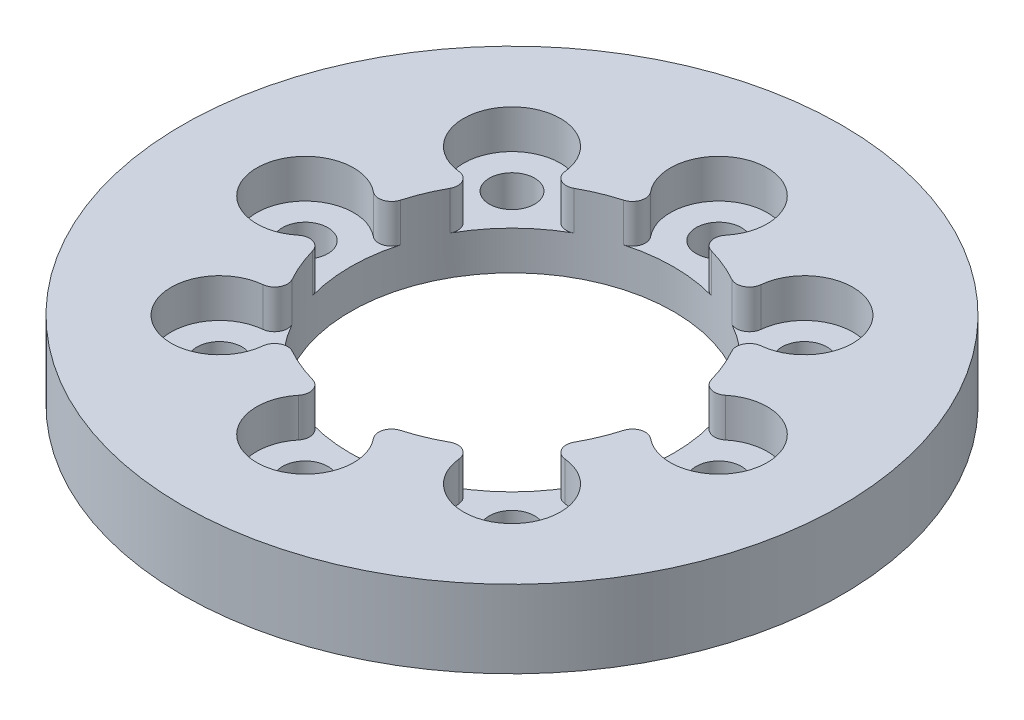
from build123d import *

# Parameters (mm, degrees)
SKETCH1_R           = 25.5
SKETCH1_R_2         = 12.5
SKETCH1_R_3         = 1.75
BOSS_EXTRUDE1_DEPTH = 6
CUT_EXTRUDE1_START  = -3
SKETCH2_R           = 3.75
SKETCH2_R_2         = 1.75
CUT_EXTRUDE1_DEPTH  = 3
FILLET1_R           = 1


with BuildPart() as part:
    # Sketch1 → Boss-Extrude1 (new body)
    with BuildSketch(Plane(origin=(0, 0, 0), x_dir=(1, 0, 0), z_dir=(0, 1, 0))):
        Circle(SKETCH1_R)
        Circle(SKETCH1_R_2, mode=Mode.SUBTRACT)
        with Locations((0, 16)):
            Circle(SKETCH1_R_3, mode=Mode.SUBTRACT)
        with Locations((11.313708499, 11.313708499)):
            Circle(SKETCH1_R_3, mode=Mode.SUBTRACT)
        with Locations((16, 0)):
            Circle(SKETCH1_R_3, mode=Mode.SUBTRACT)
        with Locations((11.313708499, -11.313708499)):
            Circle(SKETCH1_R_3, mode=Mode.SUBTRACT)
        with Locations((0, -16)):
            Circle(SKETCH1_R_3, mode=Mode.SUBTRACT)
        with Locations((-11.313708499, -11.313708499)):
            Circle(SKETCH1_R_3, mode=Mode.SUBTRACT)
        with Locations((-16, 0)):
            Circle(SKETCH1_R_3, mode=Mode.SUBTRACT)
        with Locations((-11.313708499, 11.313708499)):
            Circle(SKETCH1_R_3, mode=Mode.SUBTRACT)
    extrude(amount=BOSS_EXTRUDE1_DEPTH)

    # Sketch2 → Cut-Extrude1 (cut)
    # profile 1 of 8: a face of its own
    with BuildSketch(Plane(origin=(0, 6, 0), x_dir=(1, 0, 0), z_dir=(0, 1, 0)).offset(CUT_EXTRUDE1_START)):
        with Locations((-11.313708499, 11.313708499)):
            Circle(SKETCH2_R)
        with Locations((-11.313708499, 11.313708499)):
            Circle(SKETCH2_R_2, mode=Mode.SUBTRACT)
    # profile 2 of 8: a face of its own
    with BuildSketch(Plane(origin=(0, 6, 0), x_dir=(1, 0, 0), z_dir=(0, 1, 0)).offset(CUT_EXTRUDE1_START)):
        with Locations((-11.313708499, -11.313708499)):
            Circle(SKETCH2_R)
        with Locations((-11.313708499, -11.313708499)):
            Circle(SKETCH2_R_2, mode=Mode.SUBTRACT)
    # profile 3 of 8: a face of its own
    with BuildSketch(Plane(origin=(0, 6, 0), x_dir=(1, 0, 0), z_dir=(0, 1, 0)).offset(CUT_EXTRUDE1_START)):
        with Locations((11.313708499, -11.313708499)):
            Circle(SKETCH2_R)
        with Locations((11.313708499, -11.313708499)):
            Circle(SKETCH2_R_2, mode=Mode.SUBTRACT)
    # profile 4 of 8: a face of its own
    with BuildSketch(Plane(origin=(0, 6, 0), x_dir=(1, 0, 0), z_dir=(0, 1, 0)).offset(CUT_EXTRUDE1_START)):
        with Locations((11.313708499, 11.313708499)):
            Circle(SKETCH2_R)
        with Locations((11.313708499, 11.313708499)):
            Circle(SKETCH2_R_2, mode=Mode.SUBTRACT)
    # profile 5 of 8: a face of its own
    with BuildSketch(Plane(origin=(0, 6, 0), x_dir=(1, 0, 0), z_dir=(0, 1, 0)).offset(CUT_EXTRUDE1_START)):
        with Locations((0, 16)):
            Circle(SKETCH2_R)
        with Locations((0, 16)):
            Circle(SKETCH2_R_2, mode=Mode.SUBTRACT)
    # profile 6 of 8: a face of its own
    with BuildSketch(Plane(origin=(0, 6, 0), x_dir=(1, 0, 0), z_dir=(0, 1, 0)).offset(CUT_EXTRUDE1_START)):
        with Locations((16, 0)):
            Circle(SKETCH2_R)
        with Locations((16, 0)):
            Circle(SKETCH2_R_2, mode=Mode.SUBTRACT)
    # profile 7 of 8: a face of its own
    with BuildSketch(Plane(origin=(0, 6, 0), x_dir=(1, 0, 0), z_dir=(0, 1, 0)).offset(CUT_EXTRUDE1_START)):
        with Locations((0, -16)):
            Circle(SKETCH2_R)
        with Locations((0, -16)):
            Circle(SKETCH2_R_2, mode=Mode.SUBTRACT)
    # profile 8 of 8: a face of its own
    with BuildSketch(Plane(origin=(0, 6, 0), x_dir=(1, 0, 0), z_dir=(0, 1, 0)).offset(CUT_EXTRUDE1_START)):
        with Locations((-16, 0)):
            Circle(SKETCH2_R)
        with Locations((-16, 0)):
            Circle(SKETCH2_R_2, mode=Mode.SUBTRACT)
    extrude(amount=CUT_EXTRUDE1_DEPTH, mode=Mode.SUBTRACT)

    # Fillet1
    fillet1_edges = [part.edges().sort_by_distance(p)[0] for p in [
        (7.958305519, 4.5, -9.639262071),
        (-12.443359375, 4.5, -1.188615777),
        (-1.188615777, 4.5, -12.443359375),
        (1.188615777, 4.5, -12.443359375),
        (9.639262071, 4.5, -7.958305519),
        (12.443359375, 4.5, -1.188615777),
        (12.443359375, 4.5, 1.188615777),
        (9.639262071, 4.5, 7.958305519),
        (7.958305519, 4.5, 9.639262071),
        (-7.958305519, 4.5, -9.639262071),
        (-9.639262071, 4.5, -7.958305519),
        (1.188615777, 4.5, 12.443359375),
        (-1.188615777, 4.5, 12.443359375),
        (-12.443359375, 4.5, 1.188615777),
        (-7.958305519, 4.5, 9.639262071),
        (-9.639262071, 4.5, 7.958305519),
    ]]
    fillet(fillet1_edges, radius=FILLET1_R)


solid = part.part
